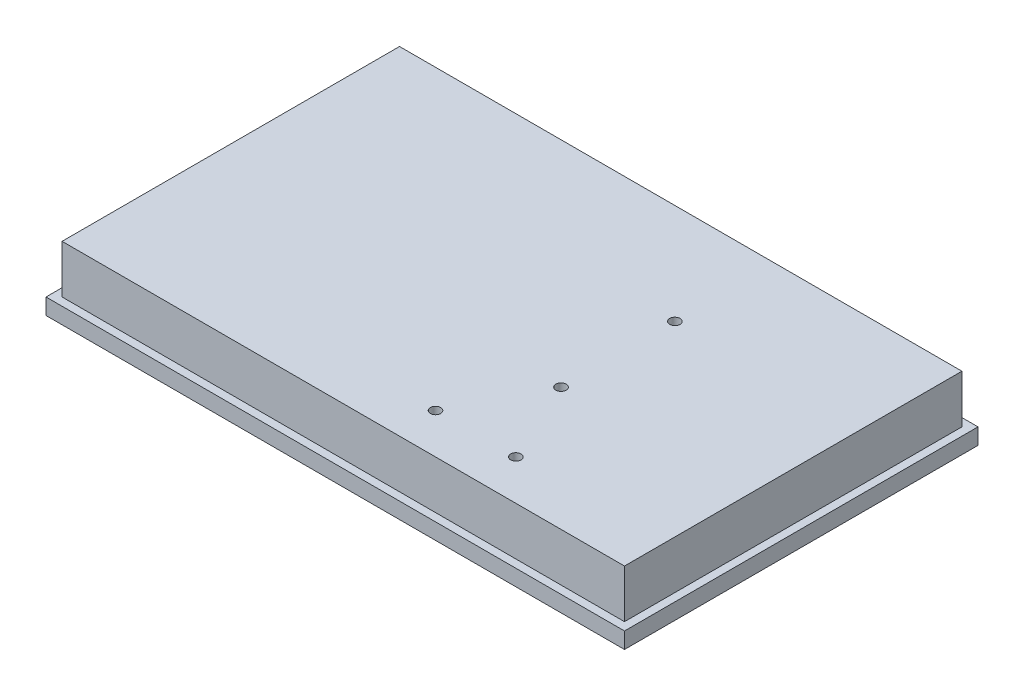
from build123d import *

# Parameters (mm, degrees)
SKETCH1_W           = 457.2
SKETCH1_H           = 279.4
BOSS_EXTRUDE1_DEPTH = 12.7
BOSS_EXTRUDE2_START = 12.7
SKETCH2_W           = 444.5
SKETCH2_H           = 266.7
BOSS_EXTRUDE2_DEPTH = 38.1
SKETCH3_R           = 4.1
CUT_EXTRUDE1_DEPTH  = 76.2
SKETCH4_R           = 7.5
CUT_EXTRUDE2_DEPTH  = 4.5


with BuildPart() as part:
    # Sketch1 → Boss-Extrude1 (new body)
    with BuildSketch(Plane(origin=(0, 0, 0), x_dir=(1, 0, 0), z_dir=(0, 1, 0))):
        Rectangle(SKETCH1_W, SKETCH1_H)
    extrude(amount=BOSS_EXTRUDE1_DEPTH)

    # Sketch2 → Boss-Extrude2 (add)
    with BuildSketch(Plane(origin=(0, 0, 0), x_dir=(1, 0, 0), z_dir=(0, 1, 0)).offset(BOSS_EXTRUDE2_START)):
        Rectangle(SKETCH2_W, SKETCH2_H)
    extrude(amount=BOSS_EXTRUDE2_DEPTH)

    # Sketch3 → Cut-Extrude1 (cut, symmetric)
    with BuildSketch(Plane(origin=(0, 0, 0), x_dir=(1, 0, 0), z_dir=(0, 1, 0))):
        with Locations((74.75, 54)):
            Circle(SKETCH3_R)
        with Locations((74.75, -36)):
            Circle(SKETCH3_R)
        with Locations((41.15, -101.6)):
            Circle(SKETCH3_R)
        with Locations((104.65, -101.6)):
            Circle(SKETCH3_R)
    extrude(amount=CUT_EXTRUDE1_DEPTH, both=True, mode=Mode.SUBTRACT)

    # Sketch4 → Cut-Extrude2 (cut, symmetric)
    with BuildSketch(Plane(origin=(0, 0, 0), x_dir=(1, 0, 0), z_dir=(0, 1, 0))):
        with Locations((41.15, -101.6)):
            Circle(SKETCH4_R)
        with Locations((104.65, -101.6)):
            Circle(SKETCH4_R)
    extrude(amount=CUT_EXTRUDE2_DEPTH, both=True, mode=Mode.SUBTRACT)


solid = part.part
